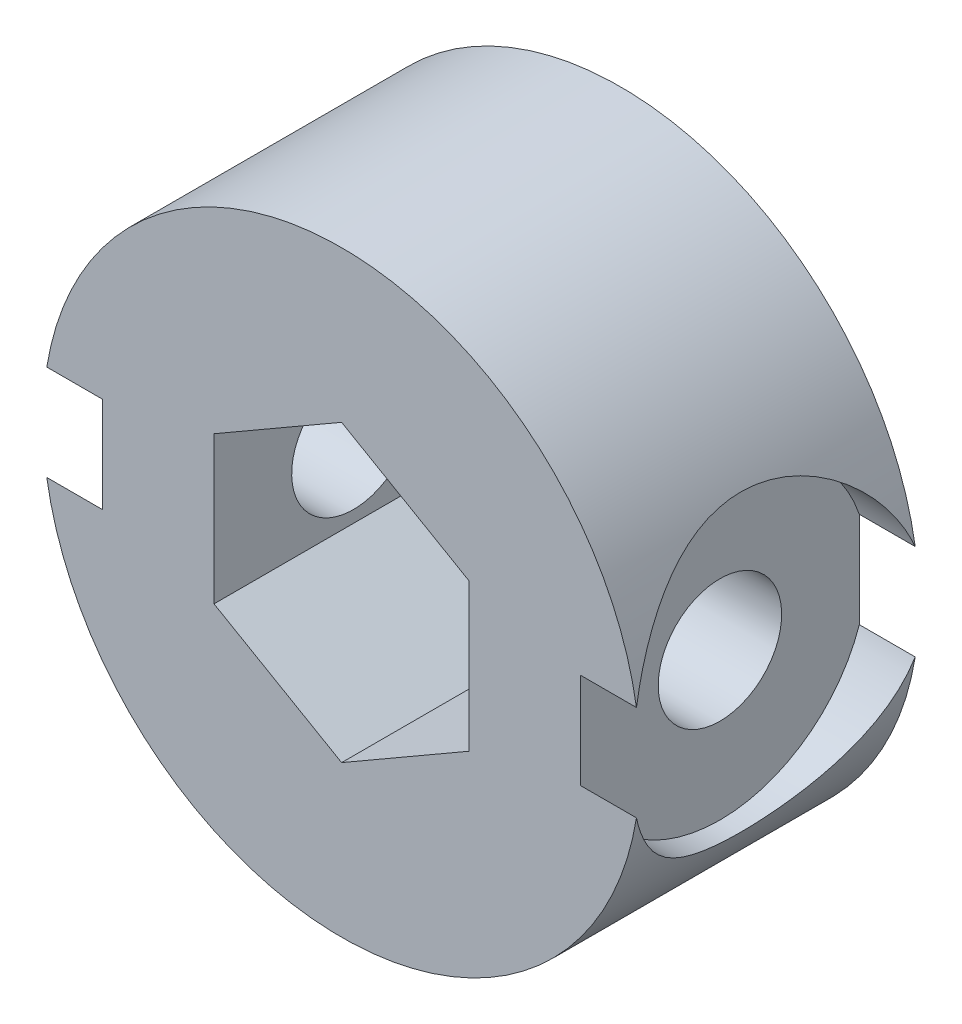
from build123d import *

# Parameters (mm, degrees)
SKETCH1_R               = 7.5
BOSS_EXTRUDE2_DEPTH     = 7
CUT_EXTRUDE1_DEPTH      = 7.5
CUT_EXTRUDE1_DEPTH_BACK = 7.5
SKETCH2_R               = 1.55
SKETCH4_R               = 3.7
CUT_EXTRUDE2_DEPTH      = 4
CUT_EXTRUDE3_START      = -4
SKETCH5_R               = 3.7
CUT_EXTRUDE3_DEPTH      = 4


with BuildPart() as part:
    # Sketch1 → Boss-Extrude2 (new body)
    with BuildSketch(Plane.XY):
        Circle(SKETCH1_R)
        Polygon((0, 3.7), (3.204293994, 1.85), (3.204293994, -1.85), (0, -3.7), (-3.204293994, -1.85), (-3.204293994, 1.85), align=None, mode=Mode.SUBTRACT)
    extrude(amount=BOSS_EXTRUDE2_DEPTH)

    # Sketch2 → Cut-Extrude1 (cut, two sides: drawn at the far end of the back side and taken through both)
    with BuildSketch(Plane.ZY.offset(-CUT_EXTRUDE1_DEPTH_BACK)):
        with Locations((3.5, 0)):
            Circle(SKETCH2_R)
    extrude(amount=CUT_EXTRUDE1_DEPTH + CUT_EXTRUDE1_DEPTH_BACK, mode=Mode.SUBTRACT)

    # Sketch4 → Cut-Extrude2 (cut)
    with BuildSketch(Plane.ZY.offset(6)):
        with Locations((3.5, 0)):
            Circle(SKETCH4_R)
    extrude(amount=CUT_EXTRUDE2_DEPTH, mode=Mode.SUBTRACT)

    # Sketch5 → Cut-Extrude3 (cut)
    with BuildSketch(Plane.ZY.offset(-6).offset(CUT_EXTRUDE3_START)):
        with Locations((3.5, 0)):
            Circle(SKETCH5_R)
    extrude(amount=CUT_EXTRUDE3_DEPTH, mode=Mode.SUBTRACT)


solid = part.part
